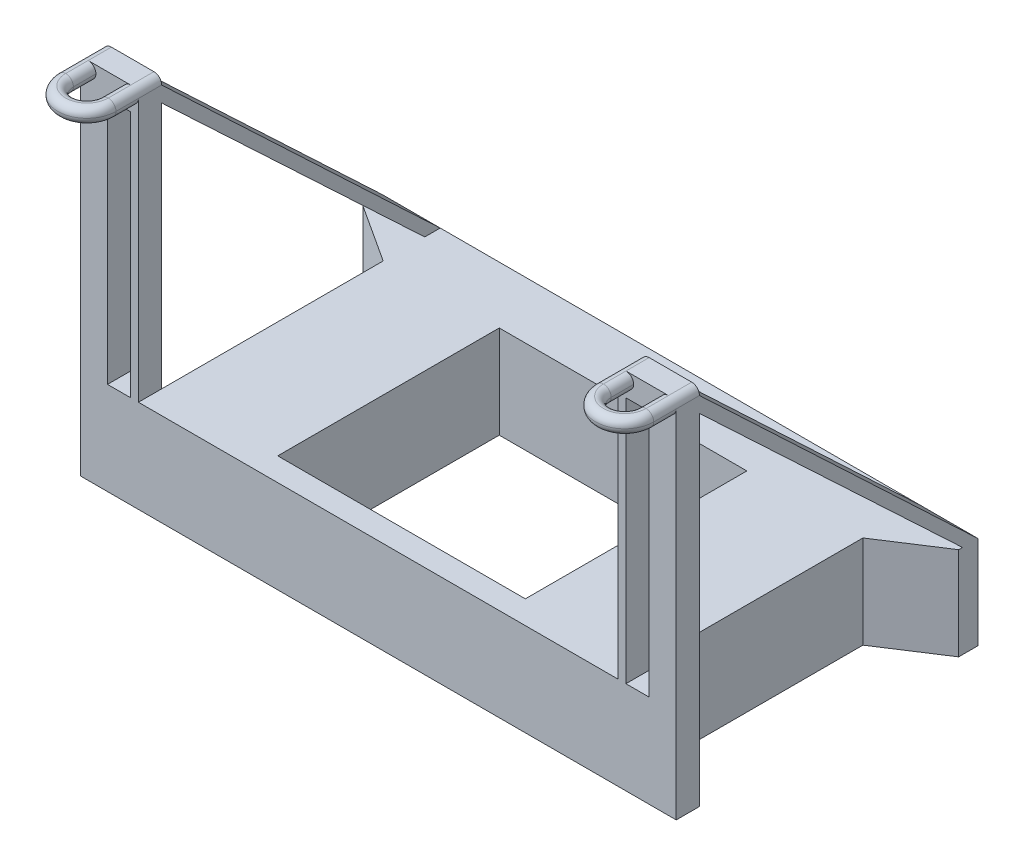
from build123d import *

# Parameters (mm, degrees)
BOSS_EXTRU_1_DEPTH           = 39
ESQUISSE2_W                  = 36
ESQUISSE2_H                  = 35
ENL_V_MAT_EXTRU_1_DEPTH      = 69.490875305
ENL_V_MAT_EXTRU_2_DEPTH      = 7.5
ENL_V_MAT_EXTRU_2_DEPTH_BACK = 39
ESQUISSE3_W                  = 3
ESQUISSE3_H                  = 32
ESQUISSE5_W                  = 7.5
ESQUISSE5_H                  = 28.5
ENL_V_MAT_EXTRU_3_DEPTH      = 66.024995194
ESQUISSE6_W                  = 2
ESQUISSE6_H                  = 2
CONG_2_R                     = 1
BOSS_EXTRU_3_DEPTH           = 7.5
CHANFREIN1_SIZE              = 5
CHANFREIN1_SIZE_2            = 7.699324819
ESQUISSE9_W                  = 5
ESQUISSE9_H                  = 28.629443051
ENL_V_MAT_EXTRU_4_DEPTH      = 6
ESQUISSE10_W                 = 16
ESQUISSE10_H                 = 28.629443051
ENL_V_MAT_EXTRU_6_DEPTH      = 76.996780236


# Some blends are built 0.0001 mm under size
with BuildPart() as part:
    # Esquisse1 → Boss.-Extru.1 (new body)
    with BuildSketch(Plane.XY):
        Polygon((-38.5, 0), (0, 0), (0, 12), (-31, 12), (-31, 47), (-38.5, 47), align=None)
    extrude(amount=BOSS_EXTRU_1_DEPTH)

    # Esquisse2 → Enlèv. mat.-Extru.1 (cut, through all)
    with BuildSketch(Plane(origin=(-31, 0, 0), x_dir=(0, 0, -1), z_dir=(1, 0, 0))):
        with Locations((-18, 29.5)):
            Rectangle(ESQUISSE2_W, ESQUISSE2_H)
    extrude(amount=-ENL_V_MAT_EXTRU_1_DEPTH, mode=Mode.SUBTRACT)

    # Esquisse3 → Enlèv. mat.-Extru.2 (cut, two sides: drawn at the far end of the back side and taken through both)
    with BuildSketch(Plane(origin=(0, 0, 36), x_dir=(-1, 0, 0), z_dir=(0, 0, -1)).offset(-ENL_V_MAT_EXTRU_2_DEPTH_BACK)):
        with Locations((33.5, 28)):
            Rectangle(ESQUISSE3_W, ESQUISSE3_H)
    extrude(amount=ENL_V_MAT_EXTRU_2_DEPTH + ENL_V_MAT_EXTRU_2_DEPTH_BACK, mode=Mode.SUBTRACT)

    # Esquisse5 → Enlèv. mat.-Extru.3 (cut, through all)
    with BuildSketch(Plane(origin=(0, 12, 0), x_dir=(1, 0, 0), z_dir=(0, 1, 0))):
        with Locations((-34.75, -21.75)):
            Rectangle(ESQUISSE5_W, ESQUISSE5_H)
    extrude(amount=-ENL_V_MAT_EXTRU_3_DEPTH, mode=Mode.SUBTRACT)

    # Balayage3: sweep along a path in Esquisse7
    with BuildLine(Plane(origin=(0, 47, 0), x_dir=(1, 0, 0), z_dir=(0, 1, 0))) as balayage3_path:
        Line((-37.5, -39), (-37.5, -41.903703094))
        ThreePointArc((-37.5, -41.903703094), (-34.75, -44.653703094), (-32, -41.903703094))
        Line((-32, -41.903703094), (-32, -39))
    # Esquisse6 → Balayage3 (sweep)
    with BuildSketch(Plane.XY.offset(39)):
        with Locations((-37.5, 46)):
            Rectangle(ESQUISSE6_W, ESQUISSE6_H)
    sweep(path=balayage3_path.line)

    # Congé2
    cong_2_edges = [part.edges().sort_by_distance(p)[0] for p in [
        (-31, 47, 38.951851547),
        (-38.5, 47, 38.951851547),
        (-31, 45, 40.451851547),
        (-33, 47, 40.451851547),
        (-38.5, 45, 40.451851547),
        (-36.5, 47, 40.451851547),
        (-33, 45, 40.451851547),
        (-34.75, 47, 45.653703094),
        (-34.75, 45, 45.653703094),
        (-34.75, 45, 43.653703094),
        (-34.75, 47, 43.653703094),
        (-36.5, 45, 40.451851547),
    ]]
    fillet(cong_2_edges, radius=CONG_2_R - 0.0001)  # a hair under: the kernel refuses the full size

    # Esquisse8 → Boss.-Extru.3 (add)
    with BuildSketch(Plane.ZY.offset(38.5)):
        Polygon((36, 46), (0, 12), (2, 12), (36, 44), align=None)
    extrude(amount=-BOSS_EXTRU_3_DEPTH)

    # Chanfrein1
    # the kernel refuses this chamfer: 7.699324819, 5 mm, written as the material it takes off along each edge
    with BuildSketch(Plane(origin=(-38.5, 31.898450737, 7.5), x_dir=(-0.04991856572298867, 0, -0.9987532912567346), z_dir=(0, -1, 0))) as chanfrein1_piece_1_section:
        Polygon((CHANFREIN1_SIZE * 0.998753291257, CHANFREIN1_SIZE * 0.049918565723), (-CHANFREIN1_SIZE_2 * 0.0499185657235, CHANFREIN1_SIZE_2 * 0.998753291266), (0, 0), align=None)
    chanfrein1_piece_1 = extrude(amount=51.796901474, mode=Mode.PRIVATE)
    chanfrein1_piece_1 = split(chanfrein1_piece_1, bisect_by=Plane(origin=(-31, 6, 5.832244488), z_dir=(-1, 0, 0)), keep=Keep.TOP, mode=Mode.PRIVATE)
    chanfrein1_piece_1 = split(chanfrein1_piece_1, bisect_by=Plane(origin=(-35.936911742, 11.0942578, 1.037648912), z_dir=(0, -0.7281999926928029, 0.685364699004991)), keep=Keep.TOP, mode=Mode.PRIVATE)
    add(chanfrein1_piece_1, mode=Mode.SUBTRACT)

    # Esquisse9 → Enlèv. mat.-Extru.4 (cut)
    with BuildSketch(Plane.XZ):
        with Locations((-23.5, 21.685278474)):
            Rectangle(ESQUISSE9_W, ESQUISSE9_H)
    extrude(amount=-ENL_V_MAT_EXTRU_4_DEPTH, mode=Mode.SUBTRACT)

    # Esquisse10 → Enlèv. mat.-Extru.6 (cut, through all)
    with BuildSketch(Plane.XZ):
        with Locations((-8, 21.685278474)):
            Rectangle(ESQUISSE10_W, ESQUISSE10_H)
    extrude(amount=-ENL_V_MAT_EXTRU_6_DEPTH, mode=Mode.SUBTRACT)

    # Symétrie1: part across plane


with BuildPart() as part_1:
    add(part.part)
    add(part.part.mirror(Plane(origin=(0, 12, 39), x_dir=(0, 0, 1), z_dir=(1, 0, 0))))


solid = part_1.part
